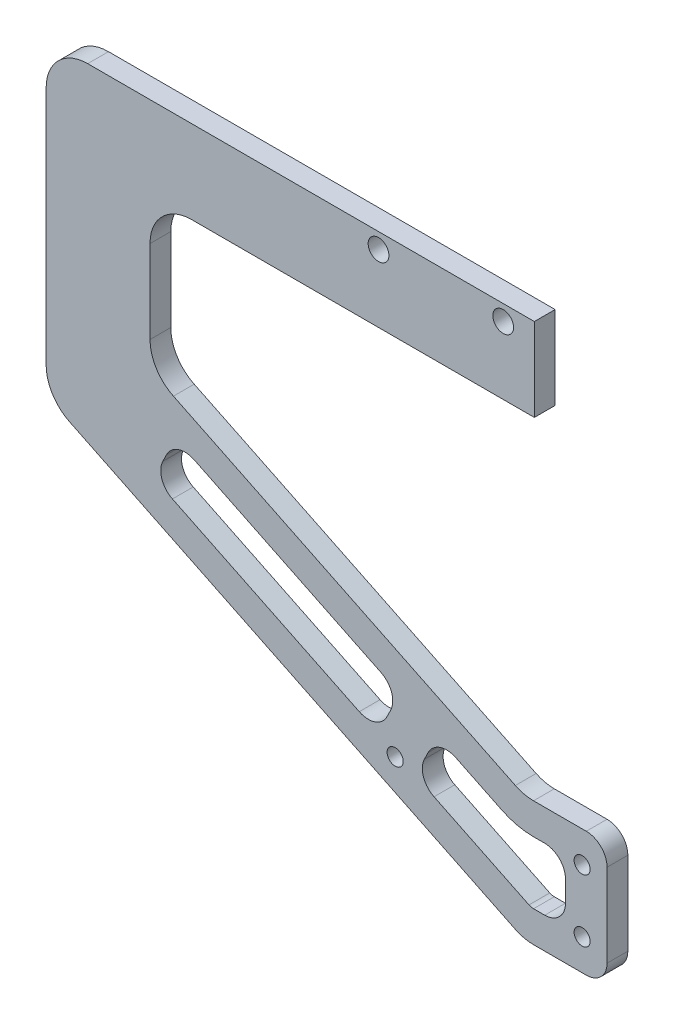
from build123d import *

# Parameters (mm, degrees)
BOSS_EXTRUDE1_DEPTH              = 6.35
F_1_4_0_25_DIAMETER_HOLE1_D      = 6.35
F_1_4_0_25_DIAMETER_HOLE1_DEPTH  = 9.652
F_1_4_0_25_DIAMETER_HOLE1_TIP    = 1.907732465
F_10_0_1935_DIAMETER_HOLE1_D     = 4.9149
F_10_0_1935_DIAMETER_HOLE1_DEPTH = 9.652
F_10_0_1935_DIAMETER_HOLE1_TIP   = 1.476584928
FILLET1_R                        = 12.7
FILLET2_R                        = 6.35
CUT_EXTRUDE2_REACH               = 240.104
FILLET3_R                        = 6.35


with BuildPart() as part:
    # Sketch1 → Boss-Extrude1 (new body)
    with BuildSketch(Plane.XY):
        with BuildLine():
            Line((0, 0), (0, 38.1))
            Line((0, 38.1), (-25.4, 38.1))
            Line((-25.4, 38.1), (-132.551492152, 90.177612557))
            ThreePointArc((-132.551492152, 90.177612557), (-137.765545744, 94.862565411), (-139.7, 101.6))
            Line((-139.7, 101.6), (-139.7, 127))
            ThreePointArc((-139.7, 127), (-135.980256121, 135.980256121), (-127, 139.7))
            Line((-127, 139.7), (-22.225, 139.7))
            Line((-22.225, 139.7), (-22.225, 165.1))
            Line((-22.225, 165.1), (-158.75, 165.1))
            ThreePointArc((-158.75, 165.1), (-167.730256121, 161.380256121), (-171.45, 152.4))
            Line((-171.45, 152.4), (-171.45, 78.931088877))
            ThreePointArc((-171.45, 78.931088877), (-169.515545744, 72.193654288), (-164.301492152, 67.508701434))
            Line((-164.301492152, 67.508701434), (-25.4, 0))
            Line((-25.4, 0), (0, 0))
        make_face()
    extrude(amount=BOSS_EXTRUDE1_DEPTH)

    # 1/4 (0.25) Diameter Hole1
    with Locations(Plane.XY.offset(6.35)):
        with Locations((-69.85, 160.3375), (-31.75, 160.3375)):
            Hole(F_1_4_0_25_DIAMETER_HOLE1_D / 2, depth=F_1_4_0_25_DIAMETER_HOLE1_DEPTH)
            with Locations((0, 0, -(F_1_4_0_25_DIAMETER_HOLE1_DEPTH + F_1_4_0_25_DIAMETER_HOLE1_TIP / 2))):  # 118° drill point
                Cone(0, F_1_4_0_25_DIAMETER_HOLE1_D / 2, F_1_4_0_25_DIAMETER_HOLE1_TIP, mode=Mode.SUBTRACT)

    # #10 (0.1935) Diameter Hole1
    with Locations(Plane.XY.offset(6.35)):
        with Locations((-7.62, 28.575), (-7.62, 9.525), (-64.77, 28.575)):
            Hole(F_10_0_1935_DIAMETER_HOLE1_D / 2, depth=F_10_0_1935_DIAMETER_HOLE1_DEPTH)
            with Locations((0, 0, -(F_10_0_1935_DIAMETER_HOLE1_DEPTH + F_10_0_1935_DIAMETER_HOLE1_TIP / 2))):  # 118° drill point
                Cone(0, F_10_0_1935_DIAMETER_HOLE1_D / 2, F_10_0_1935_DIAMETER_HOLE1_TIP, mode=Mode.SUBTRACT)

    # Fillet1
    fillet1_edges = [part.edges().sort_by_distance(p)[0] for p in [
        (-25.4, 0, 3.175),
        (-25.4, 38.1, 3.175),
    ]]
    fillet(fillet1_edges, radius=FILLET1_R)

    # Fillet2
    fillet2_edges = [part.edges().sort_by_distance(p)[0] for p in [
        (0, 0, 3.175),
        (0, 38.1, 3.175),
    ]]
    fillet(fillet2_edges, radius=FILLET2_R)

    # Sketch7 → Cut-Extrude2 (cut, up to next)
    with BuildSketch(Plane.XY.offset(6.35), mode=Mode.PRIVATE) as cut_extrude2_sk1:
        with BuildLine():
            Line((-12.7, 9.525), (-12.7, 28.575))
            Line((-12.7, 28.575), (-22.47723995, 28.575))
            ThreePointArc((-22.47723995, 28.575), (-27.461773198, 29.141166853), (-32.192351215, 30.810821975))
            Line((-32.192351215, 30.810821975), (-51.954899997, 40.415787225))
            Line((-51.954899997, 40.415787225), (-58.606707653, 26.72946251))
            Line((-58.606707653, 26.72946251), (-23.865112988, 9.844403139))
            ThreePointArc((-23.865112988, 9.844403139), (-23.189316128, 9.605880979), (-22.47723995, 9.525))
            Line((-22.47723995, 9.525), (-12.7, 9.525))
        make_face()
    cut_extrude2_tool1 = extrude(cut_extrude2_sk1.sketch, amount=-CUT_EXTRUDE2_REACH, mode=Mode.PRIVATE) & part.part
    # Sketch7 → Cut-Extrude2 (cut, up to next)
    with BuildSketch(Plane.XY.offset(6.35), mode=Mode.PRIVATE) as cut_extrude2_sk2:
        Polygon((-63.37728744, 45.967279377), (-131.911612096, 79.276232287), (-138.563419752, 65.589907571), (-70.029095096, 32.280954661), align=None)
    cut_extrude2_tool2 = extrude(cut_extrude2_sk2.sketch, amount=-CUT_EXTRUDE2_REACH, mode=Mode.PRIVATE) & part.part
    add(cut_extrude2_tool1.solids().sort_by_distance((-33.478497, 23.812084, 6.35))[0], mode=Mode.SUBTRACT)
    add(cut_extrude2_tool2.solids().sort_by_distance((-100.970354, 55.778593, 6.35))[0], mode=Mode.SUBTRACT)

    # Fillet3
    fillet3_edges = [part.edges().sort_by_distance(p)[0] for p in [
        (-12.7, 9.525, 3.175),
        (-58.606707653, 26.72946251, 3.175),
        (-12.7, 28.575, 3.175),
        (-51.954899997, 40.415787225, 3.175),
        (-138.563419752, 65.589907571, 3.175),
        (-70.029095096, 32.280954661, 3.175),
        (-63.37728744, 45.967279377, 3.175),
        (-131.911612096, 79.276232287, 3.175),
    ]]
    fillet(fillet3_edges, radius=FILLET3_R)


solid = part.part
